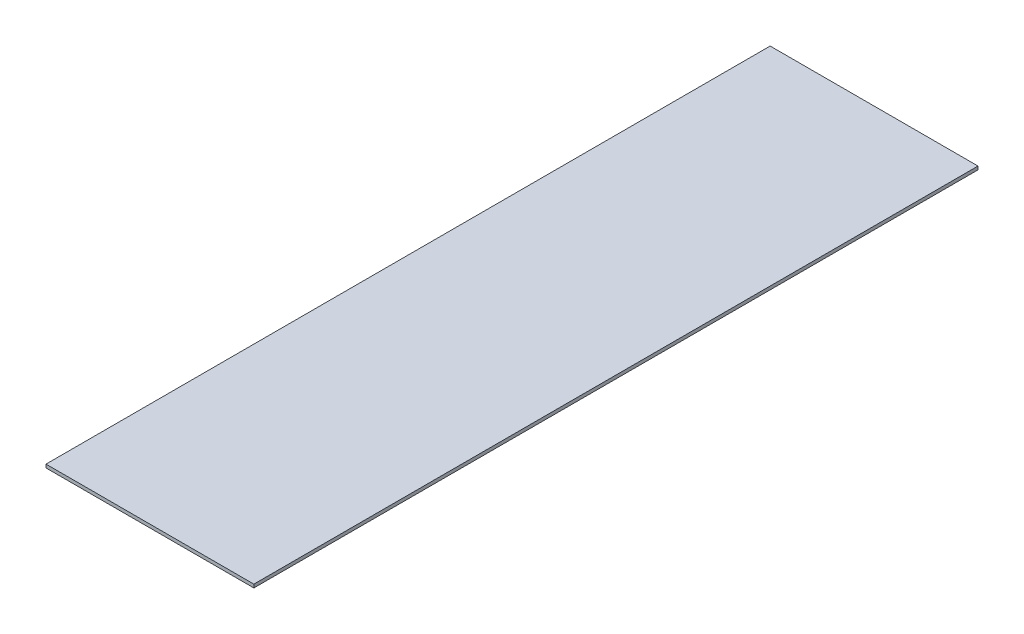
from build123d import *

# Parameters (mm, degrees)
SKETCH1_W           = 196.85
SKETCH1_H           = 685.8
BOSS_EXTRUDE1_DEPTH = 3.175


with BuildPart() as part:
    # Sketch1 → Boss-Extrude1 (new body)
    with BuildSketch(Plane(origin=(0, 0, 0), x_dir=(1, 0, 0), z_dir=(0, 1, 0))):
        with Locations((98.425, 342.9)):
            Rectangle(SKETCH1_W, SKETCH1_H)
    extrude(amount=BOSS_EXTRUDE1_DEPTH)


solid = part.part
